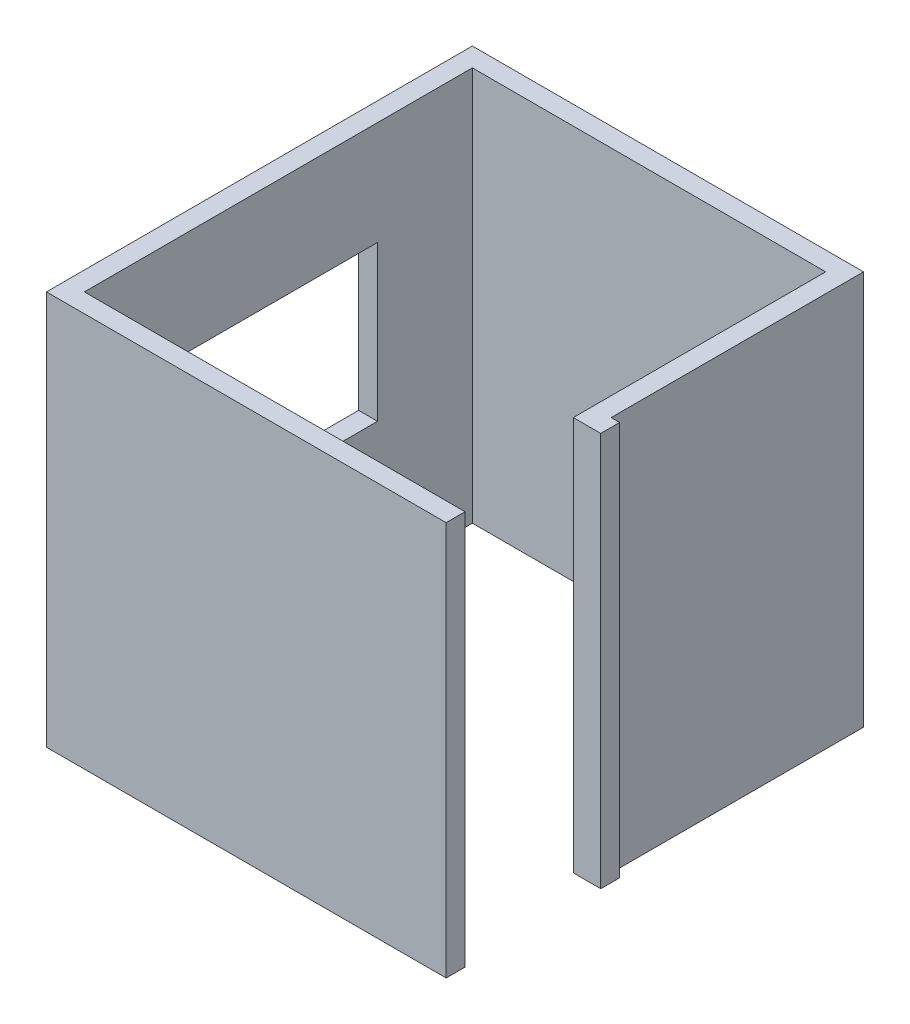
from build123d import *

# Parameters (mm, degrees)
EXTRUDE_1_DEPTH     = 2500
CUT_EXTRUDE_1_REACH = 4398.278
SKETCH_2_W          = 1370
SKETCH_2_H          = 982.146059398


with BuildPart() as part:
    # Эскиз1 → Вытянуть-Тонкостенный1 (new body)
    with BuildSketch(Plane(origin=(0, 0, 0), x_dir=(1, 0, 0), z_dir=(0, 1, 0))):
        Polygon((2413.940825756, 0), (0, 0), (0, 2460), (2240, 2460), (2240, 860), (2413.940825756, 860), (2413.940825756, 980), (2360, 980), (2360, 2580), (-120, 2580), (-120, -120), (2413.940825756, -120), align=None)
    extrude(amount=EXTRUDE_1_DEPTH)

    # Эскиз2 → Вырез-Вытянуть1 (cut, up to next)
    with BuildSketch(Plane.ZY.offset(120), mode=Mode.PRIVATE) as cut_extrude_1_sk1:
        with Locations((-1174, 1351.073029699)):
            Rectangle(SKETCH_2_W, SKETCH_2_H)
    cut_extrude_1_tool1 = extrude(cut_extrude_1_sk1.sketch, amount=-CUT_EXTRUDE_1_REACH, mode=Mode.PRIVATE) & part.part
    add(cut_extrude_1_tool1.solids().sort_by_distance((-120, 1351.07303, -1174))[0], mode=Mode.SUBTRACT)


solid = part.part
